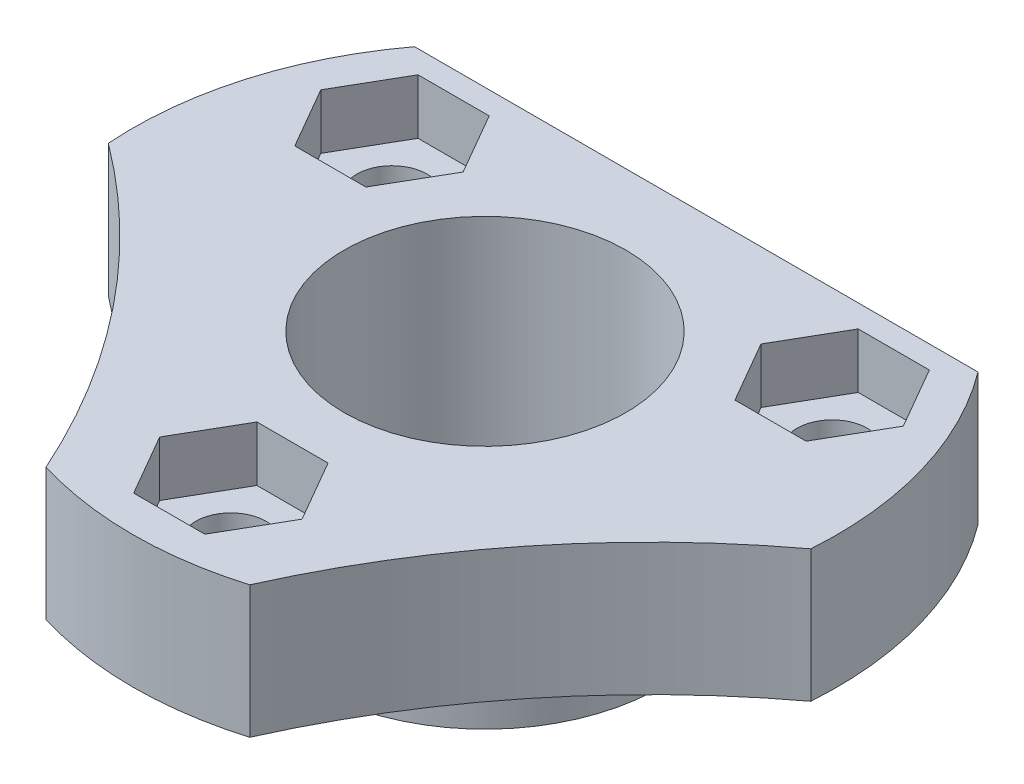
from build123d import *

# Parameters (mm, degrees)
ESQUISSE1_R             = 16
ESQUISSE1_R_2           = 6.4
ESQUISSE1_R_3           = 1.6
BOSS_EXTRU_1_DEPTH      = 6
BOSS_EXTRU_2_START      = 4
ESQUISSE2_R             = 8
ESQUISSE2_R_2           = 6.4
BOSS_EXTRU_2_DEPTH      = 4
CHANFREIN1_SIZE         = 0.5
ESQUISSE3_R             = 36
ESQUISSE3_W             = 63.993551192
ESQUISSE3_H             = 20.266671683
ENL_V_MAT_EXTRU_1_DEPTH = 25.738633754
ENL_V_MAT_EXTRU_2_DEPTH = 2.5


with BuildPart() as part:
    # Esquisse1 → Boss.-Extru.1 (new body)
    with BuildSketch(Plane(origin=(0, 0, 0), x_dir=(1, 0, 0), z_dir=(0, 1, 0))):
        Circle(ESQUISSE1_R)
        Circle(ESQUISSE1_R_2, mode=Mode.SUBTRACT)
        with Locations((0, -11.547005384)):
            Circle(ESQUISSE1_R_3, mode=Mode.SUBTRACT)
        with Locations((-10, 5.773502692)):
            Circle(ESQUISSE1_R_3, mode=Mode.SUBTRACT)
        with Locations((10, 5.773502692)):
            Circle(ESQUISSE1_R_3, mode=Mode.SUBTRACT)
    extrude(amount=BOSS_EXTRU_1_DEPTH)

    # Esquisse2 → Boss.-Extru.2 (add)
    with BuildSketch(Plane.XZ.offset(BOSS_EXTRU_2_START)):
        Circle(ESQUISSE2_R)
        Circle(ESQUISSE2_R_2, mode=Mode.SUBTRACT)
    extrude(amount=-BOSS_EXTRU_2_DEPTH)

    # Chanfrein1
    chanfrein1_edges = [part.edges().sort_by_distance(p)[0] for p in [
        (-6.4, -4, 0),
        (-8, 0, 0),
    ]]
    chamfer(chanfrein1_edges, length=CHANFREIN1_SIZE)

    # Esquisse3 → Enlèv. mat.-Extru.1 (cut, through all)
    with BuildSketch(Plane(origin=(0, 6, 0), x_dir=(1, 0, 0), z_dir=(0, 1, 0))):
        with Locations((-37.5, -30)):
            Circle(ESQUISSE3_R)
        with Locations((37.5, -30)):
            Circle(ESQUISSE3_R)
        with Locations((-0.514858099, 19.733335842)):
            Rectangle(ESQUISSE3_W, ESQUISSE3_H)
    extrude(amount=-ENL_V_MAT_EXTRU_1_DEPTH, mode=Mode.SUBTRACT)

    # Esquisse4 → Enlèv. mat.-Extru.2 (cut)
    with BuildSketch(Plane(origin=(0, 6, 0), x_dir=(1, 0, 0), z_dir=(0, 1, 0))):
        Polygon((-8.383419246, 2.973502692), (-6.766838493, 5.773502692), (-8.383419246, 8.573502692), (-11.616580754, 8.573502692), (-13.233161507, 5.773502692), (-11.616580754, 2.973502692), align=None)
        Polygon((11.616580754, 2.973502692), (13.233161507, 5.773502692), (11.616580754, 8.573502692), (8.383419246, 8.573502692), (6.766838493, 5.773502692), (8.383419246, 2.973502692), align=None)
        Polygon((1.616580754, -14.347005384), (3.233161507, -11.547005384), (1.616580754, -8.747005384), (-1.616580754, -8.747005384), (-3.233161507, -11.547005384), (-1.616580754, -14.347005384), align=None)
    extrude(amount=-ENL_V_MAT_EXTRU_2_DEPTH, mode=Mode.SUBTRACT)


solid = part.part
